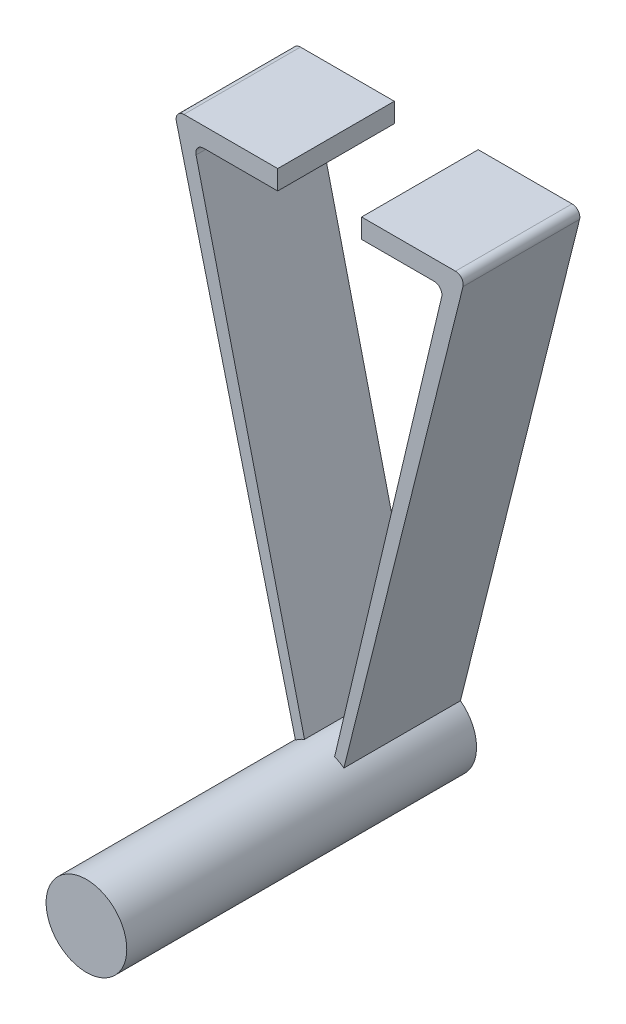
from build123d import *

# Parameters (mm, degrees)
BOSS_EXTRUDE1_DEPTH = 30
FILLET1_R           = 2
SKETCH2_R           = 10.376747572
BOSS_EXTRUDE2_DEPTH = 30
BOSS_EXTRUDE3_START = 30
SKETCH3_R           = 10.376747572
BOSS_EXTRUDE3_DEPTH = 30


with BuildPart() as part:
    # Sketch1 → Boss-Extrude1 (new body)
    with BuildSketch(Plane.XY):
        Polygon((-10.792185385, 75), (-37.5, 75), (0, -75), (37.5, 75), (10.792185385, 75), (10.792185385, 70), (31.983238879, 70), (0, -65), (-32.396004228, 70), (-10.792185385, 70), align=None)
    extrude(amount=BOSS_EXTRUDE1_DEPTH)

    # Fillet1
    fillet1_edges = [part.edges().sort_by_distance(p)[0] for p in [
        (0, -75, 15),
        (0, -65, 15),
        (37.5, 75, 15),
        (-37.5, 75, 15),
        (31.983238879, 70, 15),
        (-32.396004228, 70, 15),
    ]]
    fillet(fillet1_edges, radius=FILLET1_R)

    # Sketch2 → Boss-Extrude2 (add, symmetric)
    with BuildSketch(Plane.XY.offset(30)):
        with Locations((-0.009580232, -58.377046655)):
            Circle(SKETCH2_R)
    extrude(amount=BOSS_EXTRUDE2_DEPTH, both=True)

    # Sketch3 → Boss-Extrude3 (add)
    with BuildSketch(Plane.XY.offset(60).offset(BOSS_EXTRUDE3_START)):
        with Locations((-0.009580232, -58.377046655)):
            Circle(SKETCH3_R)
    extrude(amount=-BOSS_EXTRUDE3_DEPTH)


solid = part.part
